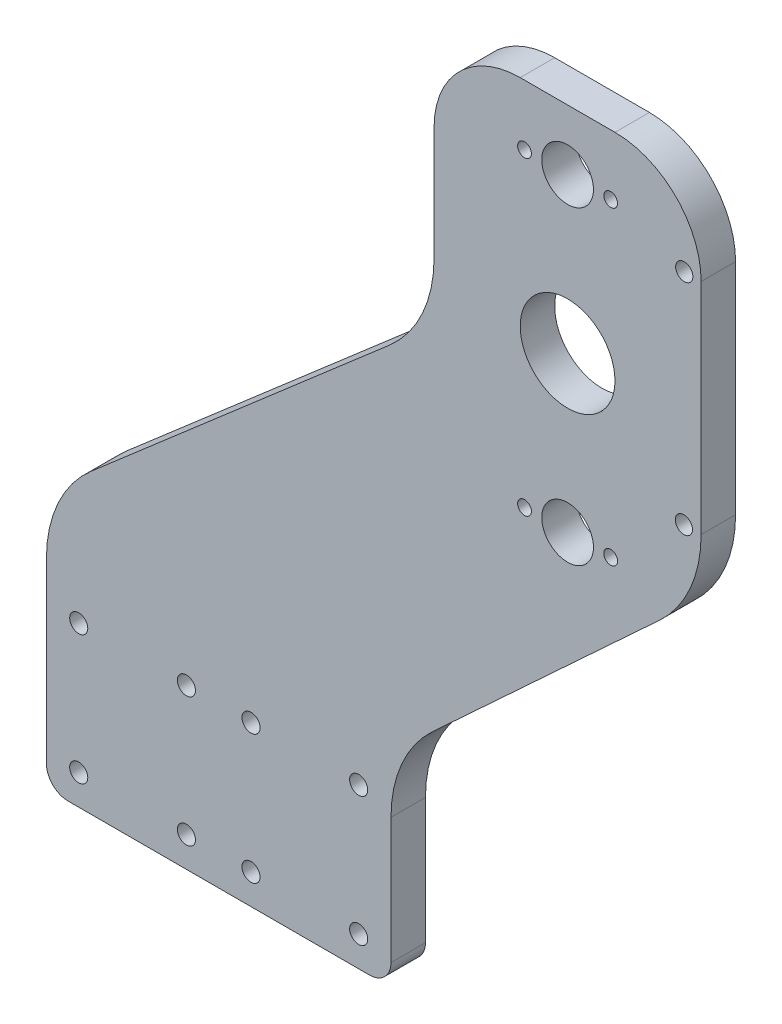
from build123d import *

# Parameters (mm, degrees)
SKETCH1_R           = 2.1
SKETCH1_R_2         = 6
SKETCH1_R_3         = 11
SKETCH1_R_4         = 2
SKETCH1_R_5         = 1.6
BOSS_EXTRUDE1_DEPTH = 8


with BuildPart() as part:
    # Sketch1 → Boss-Extrude1 (new body)
    with BuildSketch(Plane.XY):
        with BuildLine():
            Line((-58.706905953, -89.435290589), (11.293094047, -89.435290589))
            ThreePointArc((11.293094047, -89.435290589), (14.828627953, -87.970824495), (16.293094047, -84.435290589))
            Line((16.293094047, -84.435290589), (16.293094047, -55.206132823))
            ThreePointArc((16.293094047, -55.206132823), (18.805483161, -43.188177597), (25.921843901, -33.18314103))
            Line((25.921843901, -33.18314103), (78.664344192, 15.603630397))
            ThreePointArc((78.664344192, 15.603630397), (85.780704932, 25.608666964), (88.293094047, 37.62662219))
            Line((88.293094047, 37.62662219), (88.293094047, 88.509385275))
            ThreePointArc((88.293094047, 88.509385275), (82.43522967, 102.651520898), (68.293094047, 108.509385275))
            Line((68.293094047, 108.509385275), (46.293094047, 108.509385275))
            ThreePointArc((46.293094047, 108.509385275), (32.150958423, 102.651520898), (26.293094047, 88.509385275))
            Line((26.293094047, 88.509385275), (26.293094047, 62.214617761))
            ThreePointArc((26.293094047, 62.214617761), (23.580441162, 49.748636556), (15.93304822, 39.537047343))
            Line((15.93304822, 39.537047343), (-53.346860127, -20.462952657))
            ThreePointArc((-53.346860127, -20.462952657), (-60.994253069, -30.674541871), (-63.706905953, -43.140523075))
            Line((-63.706905953, -43.140523075), (-63.706905953, -84.435290589))
            ThreePointArc((-63.706905953, -84.435290589), (-62.242439859, -87.970824495), (-58.706905953, -89.435290589))
        make_face()
        with Locations((-56.206905953, -52.435290589)):
            Circle(SKETCH1_R, mode=Mode.SUBTRACT)
        with Locations((-31.206905953, -52.435290589)):
            Circle(SKETCH1_R, mode=Mode.SUBTRACT)
        with Locations((-31.206905953, -82.435290589)):
            Circle(SKETCH1_R, mode=Mode.SUBTRACT)
        with Locations((-56.206905953, -82.435290589)):
            Circle(SKETCH1_R, mode=Mode.SUBTRACT)
        with Locations((8.793094047, -82.435290589)):
            Circle(SKETCH1_R, mode=Mode.SUBTRACT)
        with Locations((-16.206905953, -82.435290589)):
            Circle(SKETCH1_R, mode=Mode.SUBTRACT)
        with Locations((-16.206905953, -52.435290589)):
            Circle(SKETCH1_R, mode=Mode.SUBTRACT)
        with Locations((8.793094047, -52.435290589)):
            Circle(SKETCH1_R, mode=Mode.SUBTRACT)
        with Locations((57.293094047, 94.509385275)):
            Circle(SKETCH1_R_2, mode=Mode.SUBTRACT)
        with Locations((57.293094047, 22.569385275)):
            Circle(SKETCH1_R_2, mode=Mode.SUBTRACT)
        with Locations((57.293094047, 58.539385275)):
            Circle(SKETCH1_R_3, mode=Mode.SUBTRACT)
        with Locations((84.293094047, 37.62662219)):
            Circle(SKETCH1_R_4, mode=Mode.SUBTRACT)
        with Locations((84.375885899, 88.528341433)):
            Circle(SKETCH1_R_4, mode=Mode.SUBTRACT)
        with Locations((47.293094047, 94.509385275)):
            Circle(SKETCH1_R_5, mode=Mode.SUBTRACT)
        with Locations((47.293094047, 22.569385275)):
            Circle(SKETCH1_R_5, mode=Mode.SUBTRACT)
        with Locations((67.293094047, 94.509385275)):
            Circle(SKETCH1_R_5, mode=Mode.SUBTRACT)
        with Locations((67.293094047, 22.569385275)):
            Circle(SKETCH1_R_5, mode=Mode.SUBTRACT)
    extrude(amount=BOSS_EXTRUDE1_DEPTH)


solid = part.part
